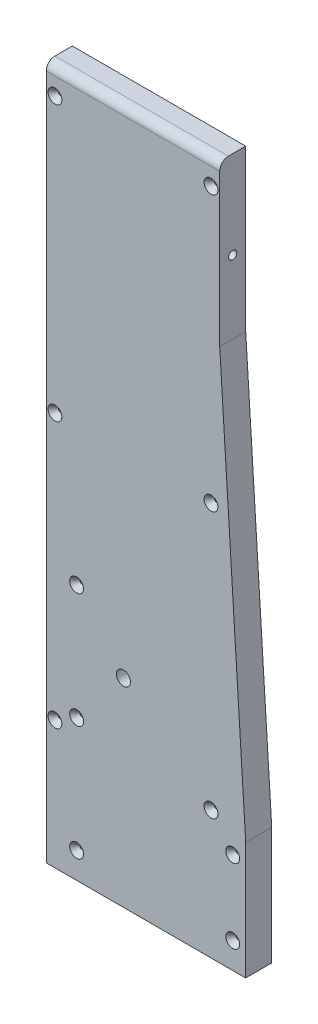
from build123d import *

# Parameters (mm, degrees)
BOSS_EXTRUDE1_DEPTH                  = 19.05
F_3_8_CLEARANCE_HOLE1_D              = 10.31748
HOLE1_D                              = 3.175
HOLE1_DEPTH                          = 50.8
HOLE1_CSINK_D                        = 10.16
HOLE1_CSINK_ANGLE                    = 82
HOLE1_TIP                            = 0.953866233
F_15_64_0_23438_DIAMETER_HOLE1_D     = 5.953252
F_15_64_0_23438_DIAMETER_HOLE1_DEPTH = 23.611462659
F_15_64_0_23438_DIAMETER_HOLE1_TIP   = 1.788537341
FILLET1_R                            = 6.35


with BuildPart() as part:
    # Sketch1 → Boss-Extrude1 (new body)
    with BuildSketch(Plane.XY):
        Polygon((82.03946, -5024.878404071), (82.03946, -5533.415502988), (228.088766336, -5533.415502988), (228.088766336, -5447.34166837), (209.03946, -5142.552766987), (209.03946, -5024.878404071), align=None)
    extrude(amount=BOSS_EXTRUDE1_DEPTH)

    # 3/8 Clearance Hole1 (through all)
    with Locations(Plane.XY.offset(19.05)):
        with Locations((138.550999994, -5387.96381451)):
            Hole(F_3_8_CLEARANCE_HOLE1_D / 2)

    # Hole1
    with Locations(Plane(origin=(0, -5562.870276207, 19.05), x_dir=(1, 0, 0), z_dir=(0, 0, 1))):
        with Locations((218.563766336, 102.817509219), (218.563766336, 48.504773219), (202.68946, 123.306744588), (202.68946, 317.949308361), (202.68946, 518.941872135), (88.38946, 518.941872135), (88.38946, 317.949308361), (88.38946, 123.306744588), (104.263766336, 216.849631358), (104.263766336, 132.677202288), (104.263766336, 48.504773219), (-104.263766336, 48.504773219), (-104.263766336, 132.677202288), (-104.263766336, 216.849631358), (-88.38946, 123.306744588), (-88.38946, 317.949308361), (-88.38946, 518.941872135), (-202.68946, 518.941872135), (-202.68946, 317.949308361), (-202.68946, 123.306744588), (-218.563766336, 48.504773219), (-218.563766336, 102.817509219)):
            CounterSinkHole(HOLE1_D / 2, HOLE1_CSINK_D / 2, depth=HOLE1_DEPTH, counter_sink_angle=HOLE1_CSINK_ANGLE)
            with Locations((0, 0, -(HOLE1_DEPTH + HOLE1_TIP / 2))):  # 118° drill point
                Cone(0, HOLE1_D / 2, HOLE1_TIP, mode=Mode.SUBTRACT)

    # 15/64 (0.23438) Diameter Hole1
    with Locations(Plane(origin=(209.03946, 0, 0), x_dir=(0, 0, -1), z_dir=(1, 0, 0))):
        with Locations((-9.526574029, -5089.226125561)):
            Hole(F_15_64_0_23438_DIAMETER_HOLE1_D / 2, depth=F_15_64_0_23438_DIAMETER_HOLE1_DEPTH)
            with Locations((0, 0, -(F_15_64_0_23438_DIAMETER_HOLE1_DEPTH + F_15_64_0_23438_DIAMETER_HOLE1_TIP / 2))):  # 118° drill point
                Cone(0, F_15_64_0_23438_DIAMETER_HOLE1_D / 2, F_15_64_0_23438_DIAMETER_HOLE1_TIP, mode=Mode.SUBTRACT)

    # Fillet1
    fillet1_edges = [part.edges().sort_by_distance(p)[0] for p in [
        (145.53946, -5024.878404071, 19.05),
    ]]
    fillet(fillet1_edges, radius=FILLET1_R)


solid = part.part
